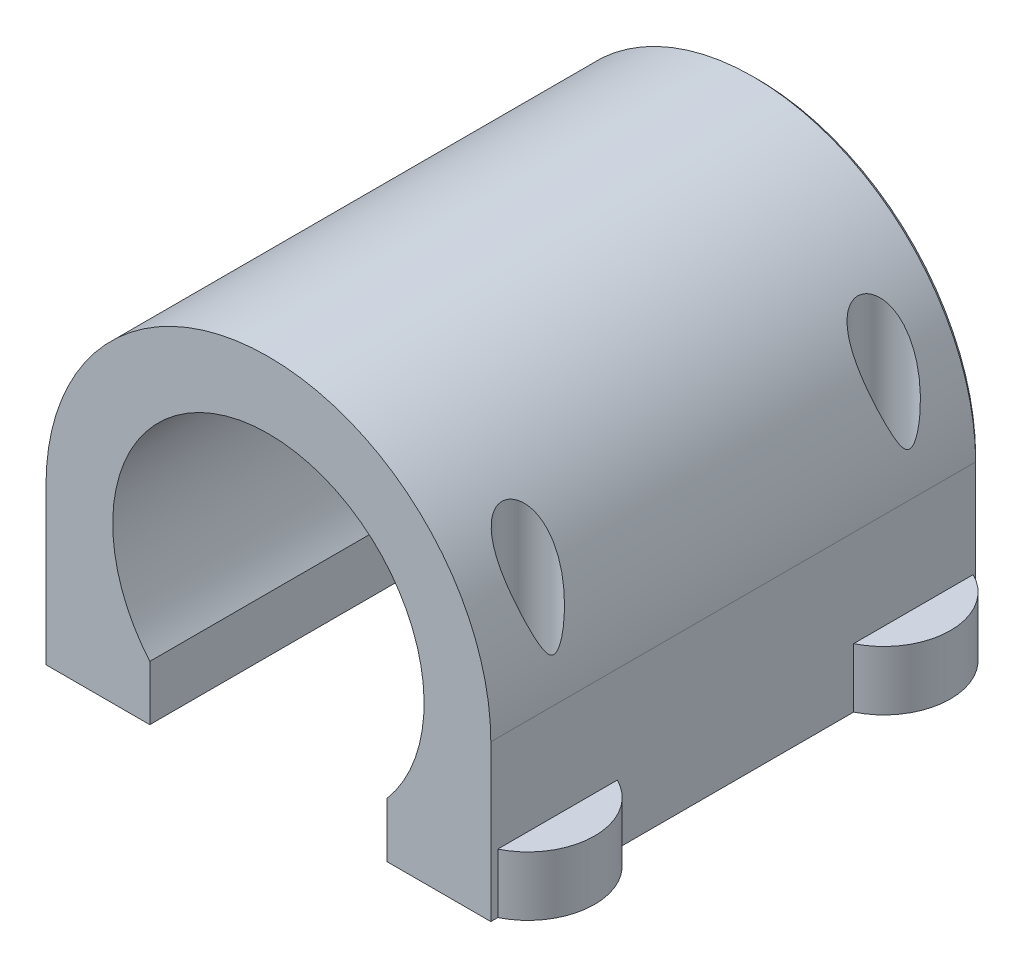
from build123d import *

# Parameters (mm, degrees)
BOSS_EXTRUDE1_DEPTH     = 33
SKETCH4_R               = 4.5
BOSS_EXTRUDE2_DEPTH     = 4
SKETCH2_R               = 1.75
CUT_EXTRUDE1_DEPTH      = 30
CHAMFER1_SIZE           = 0.3
MIRROR4_COPY_1_SKETCH_R = 4.5
MIRROR4_COPY_1_DEPTH    = 4
MIRROR4_COPY_2_SKETCH_R = 1.75
MIRROR4_COPY_2_DEPTH    = 30


with BuildPart() as part:
    # Sketch1 → Boss-Extrude1 (new body)
    with BuildSketch(Plane.XY):
        with BuildLine():
            Line((8, -6.800735254), (8, -10.5))
            Line((8, -10.5), (15, -10.5))
            Line((15, -10.5), (15, 0))
            ThreePointArc((15, 0), (0, 15), (-15, 0))
            Line((-15, 0), (-15, -10.5))
            Line((-15, -10.5), (-8, -10.5))
            Line((-8, -10.5), (-8, -6.800735254))
            ThreePointArc((-8, -6.800735254), (0, 10.5), (8, -6.800735254))
        make_face()
    extrude(amount=BOSS_EXTRUDE1_DEPTH)

    # Sketch4 → Boss-Extrude2 (add)
    with BuildSketch(Plane.XZ.offset(10.5)):
        with Locations((13, 28.5)):
            Circle(SKETCH4_R)
    boss_extrude2 = extrude(amount=-BOSS_EXTRUDE2_DEPTH)

    # Sketch2 → Cut-Extrude1 (cut)
    with BuildSketch(Plane.XZ.offset(10.5)):
        with Locations((13, 28.5)):
            Circle(SKETCH2_R)
    cut_extrude1 = extrude(amount=-CUT_EXTRUDE1_DEPTH, mode=Mode.SUBTRACT)

    # Chamfer1
    chamfer1_edges = [part.edges().sort_by_distance(p)[0] for p in [
        (-15, -5.25, 0),
        (-11.5, -10.5, 0),
        (-8, -8.650367627, 0),
        (0, 10.5, 0),
        (8, -8.650367627, 0),
        (11.5, -10.5, 0),
        (15, -5.25, 0),
        (0, 15, 0),
    ]]
    chamfer(chamfer1_edges, length=CHAMFER1_SIZE)

    # Mirror3: Boss-Extrude2, Cut-Extrude1 across plane
    add(boss_extrude2.mirror(Plane.XY.offset(16.5)))
    add(cut_extrude1.mirror(Plane.XY.offset(16.5)), mode=Mode.SUBTRACT)

    # Mirror4: Boss-Extrude2, Cut-Extrude1 across plane
    add(boss_extrude2.mirror(Plane(origin=(0, 0, 0), x_dir=(0, 0, 1), z_dir=(1, 0, 0))))
    add(cut_extrude1.mirror(Plane(origin=(0, 0, 0), x_dir=(0, 0, 1), z_dir=(1, 0, 0))), mode=Mode.SUBTRACT)

    # Mirror4 copy 1 sketch → Mirror4 copy 1 (add)
    with BuildSketch(Plane(origin=(0, -10.5, 33), x_dir=(-1, 0, 0), z_dir=(0, -1, 0))):
        with Locations((13, 28.5)):
            Circle(MIRROR4_COPY_1_SKETCH_R)
    extrude(amount=-MIRROR4_COPY_1_DEPTH)

    # Mirror4 copy 2 sketch → Mirror4 copy 2 (cut)
    with BuildSketch(Plane(origin=(0, -10.5, 33), x_dir=(-1, 0, 0), z_dir=(0, -1, 0))):
        with Locations((13, 28.5)):
            Circle(MIRROR4_COPY_2_SKETCH_R)
    extrude(amount=-MIRROR4_COPY_2_DEPTH, mode=Mode.SUBTRACT)


solid = part.part
